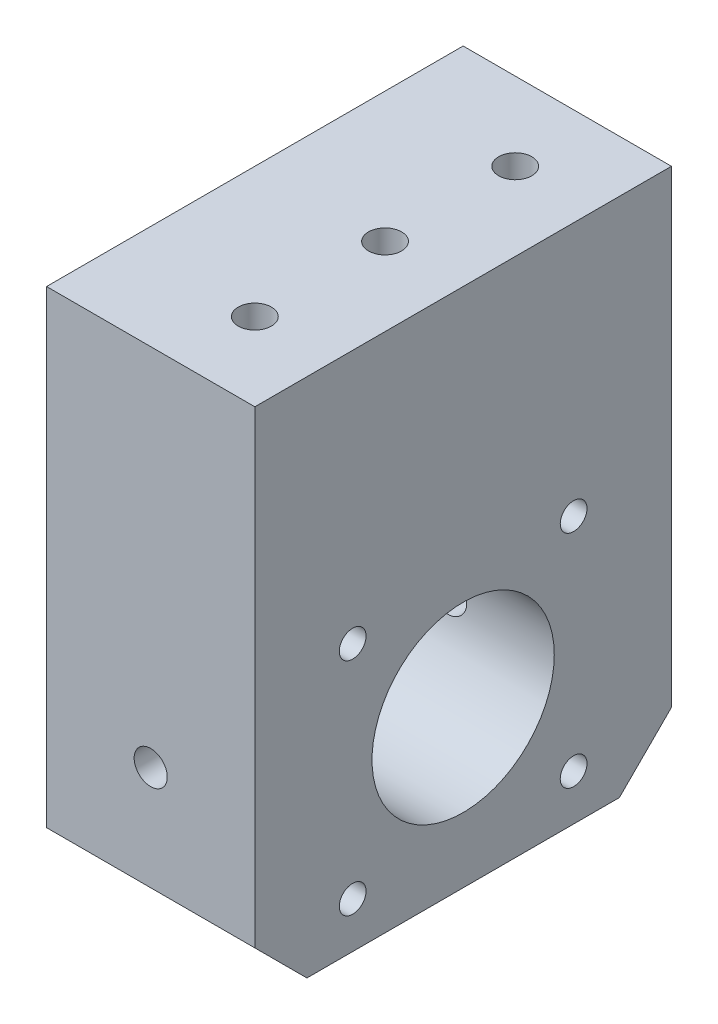
from build123d import *

# Parameters (mm, degrees)
SKETCH1_W                                      = 50.8
SKETCH1_H                                      = 63.5
BASE_DEPTH                                     = 25.4
F_7_8_0_875_DIAMETER_HOLE1_D                   = 22.225
F_10_32_TAPPED_HOLE1_D                         = 4.0386
F_10_32_TAPPED_HOLE1_DEPTH                     = 25.4
F_10_32_TAPPED_HOLE1_TIP                       = 1.213317848
CBORE_FOR_4_SOCKET_HEAD_CAP_SCREW1_D           = 3.2639
CBORE_FOR_4_SOCKET_HEAD_CAP_SCREW1_CBORE_D     = 5.55752
CBORE_FOR_4_SOCKET_HEAD_CAP_SCREW1_CBORE_DEPTH = 2.8448
CIRPATTERN1_COUNT                              = 4
CHAMFER2_SIZE                                  = 6.35
F_10_32_TAPPED_HOLE2_D                         = 4.0386


with BuildPart() as part:
    # Sketch1 → Base (new body)
    with BuildSketch(Plane(origin=(0, 0, 0), x_dir=(0, 0, -1), z_dir=(1, 0, 0))):
        Rectangle(SKETCH1_W, SKETCH1_H)
    extrude(amount=BASE_DEPTH)

    # 7/8 (0.875) Diameter Hole1 (through all)
    with Locations(Plane(origin=(25.4, 0, 0), x_dir=(0, 0, -1), z_dir=(1, 0, 0))):
        with Locations((0, -12.7)):
            Hole(F_7_8_0_875_DIAMETER_HOLE1_D / 2)

    # #10-32 Tapped Hole1
    with Locations(Plane(origin=(0, 31.75, 0), x_dir=(1, 0, 0), z_dir=(0, 1, 0))):
        with Locations((15.875, 15.875), (15.875, -15.875), (15.875, 0)):
            Hole(F_10_32_TAPPED_HOLE1_D / 2, depth=F_10_32_TAPPED_HOLE1_DEPTH)
            with Locations((0, 0, -(F_10_32_TAPPED_HOLE1_DEPTH + F_10_32_TAPPED_HOLE1_TIP / 2))):  # 118° drill point
                Cone(0, F_10_32_TAPPED_HOLE1_D / 2, F_10_32_TAPPED_HOLE1_TIP, mode=Mode.SUBTRACT)

    # CBORE for #4 Socket Head Cap Screw1 (through all)
    with Locations(Plane.ZY):
        with Locations((-13.470384182, 0.770384182)):
            cbore_for_4_socket_head_cap_screw1 = CounterBoreHole(CBORE_FOR_4_SOCKET_HEAD_CAP_SCREW1_D / 2, CBORE_FOR_4_SOCKET_HEAD_CAP_SCREW1_CBORE_D / 2, CBORE_FOR_4_SOCKET_HEAD_CAP_SCREW1_CBORE_DEPTH)

    # CirPattern1: CBORE for #4 Socket Head Cap Screw1 ×4 about axis
    cirpattern1_axis = Axis((0, -12.7, 0), (1, 0, 0))
    for i in range(1, CIRPATTERN1_COUNT):
        add(cbore_for_4_socket_head_cap_screw1.rotate(cirpattern1_axis, i * 360 / CIRPATTERN1_COUNT), mode=Mode.SUBTRACT)

    # Chamfer2
    chamfer2_edges = [part.edges().sort_by_distance(p)[0] for p in [
        (12.7, -31.75, 25.4),
        (12.7, -31.75, -25.4),
    ]]
    chamfer(chamfer2_edges, length=CHAMFER2_SIZE)

    # #10-32 Tapped Hole2 (through all)
    with Locations(Plane(origin=(0, 0, -25.4), x_dir=(-1, 0, 0), z_dir=(0, 0, -1))):
        with Locations((-12.7, -12.7)):
            Hole(F_10_32_TAPPED_HOLE2_D / 2)


solid = part.part
